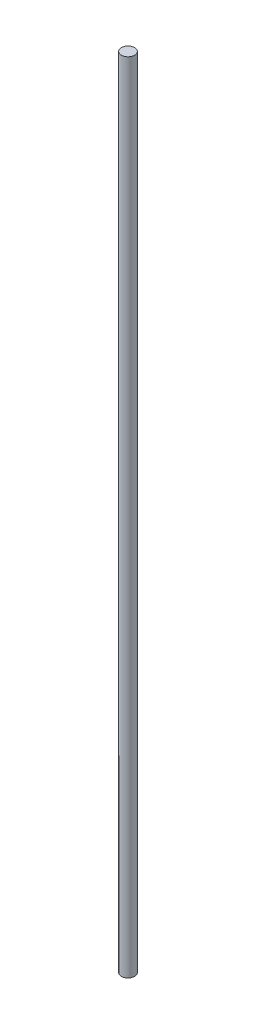
from build123d import *

# Parameters (mm, degrees)
SKETCH1_R           = 1.5
BOSS_EXTRUDE1_DEPTH = 87.5
BOSS_EXTRUDE2_START = 6
SKETCH2_R           = 1.5
BOSS_EXTRUDE2_DEPTH = 6


with BuildPart() as part:
    # Sketch1 → Boss-Extrude1 (new, symmetric)
    with BuildSketch(Plane(origin=(0, 0, 0), x_dir=(1, 0, 0), z_dir=(0, 1, 0))):
        Circle(SKETCH1_R)
    extrude(amount=BOSS_EXTRUDE1_DEPTH, both=True)

    # Sketch2 → Boss-Extrude2 (add)
    with BuildSketch(Plane(origin=(0, 87.5, 0), x_dir=(1, 0, 0), z_dir=(0, 1, 0)).offset(BOSS_EXTRUDE2_START)):
        Circle(SKETCH2_R)
    extrude(amount=-BOSS_EXTRUDE2_DEPTH)


solid = part.part
